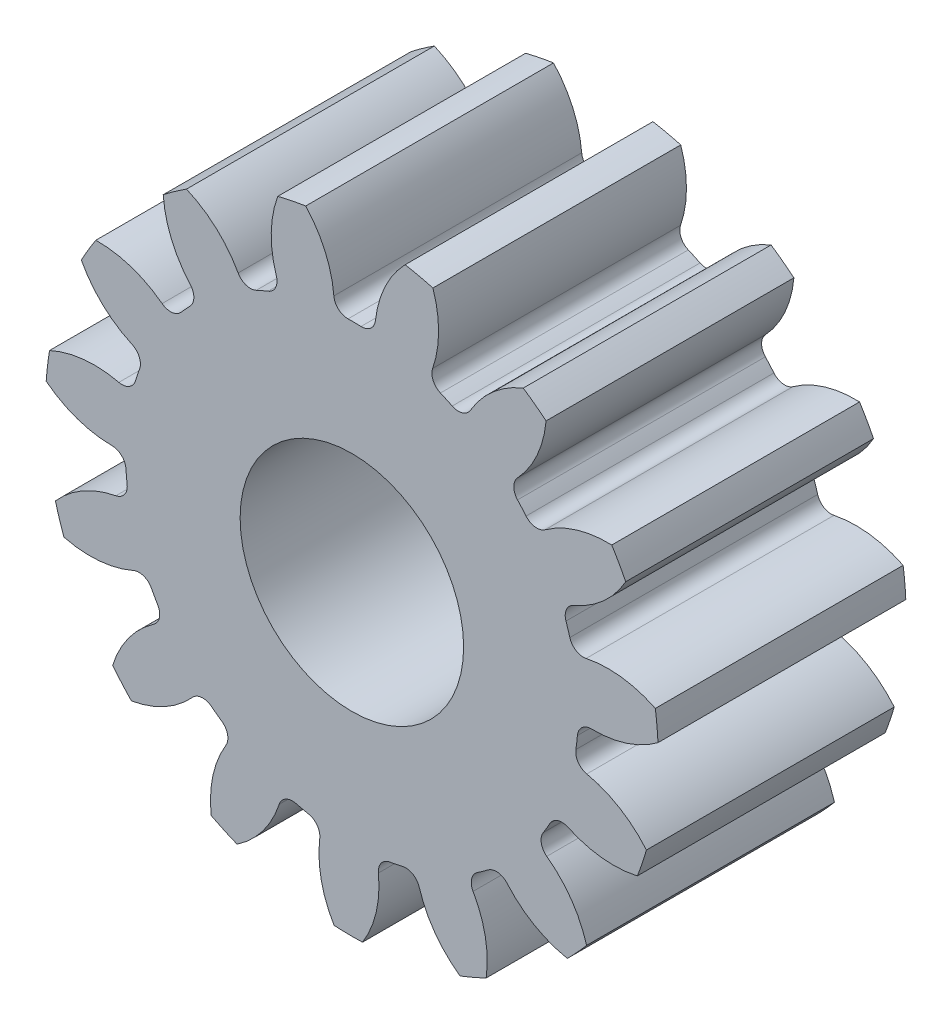
from build123d import *

# Parameters (mm, degrees)
SKETCH3_R         = 21.59
GEARBODY_DEPTH    = 17.4625
TOOTHCUT_DEPTH    = 36.173784361
CIRPATTERN1_COUNT = 15
BOREDIA_R         = 7.874
BORE_DEPTH        = 12700


with BuildPart() as part:
    # Sketch3 → gearBody (new body)
    with BuildSketch(Plane.XY):
        Circle(SKETCH3_R)
    extrude(amount=GEARBODY_DEPTH)

    # Sketch2 → toothCut (cut, through all)
    with BuildSketch(Plane.XY):
        with BuildLine():
            ThreePointArc((15.783846764, -2.304552616), (15.843293638, -1.852249483), (15.889781974, -1.39843136))
            ThreePointArc((15.889781974, -1.39843136), (16.213055843, -0.751556907), (16.890861518, -0.499501321))
            ThreePointArc((16.890861518, -0.499501321), (20.504912911, 0.340315353), (23.283949955, 2.798691365))
            ThreePointArc((23.283949955, 2.798691365), (23.292901215, -2.723187818), (22.010467945, -8.09409042))
            ThreePointArc((22.010467945, -8.09409042), (19.873444675, -5.060974685), (16.550574786, -3.410158156))
            ThreePointArc((16.550574786, -3.410158156), (15.949189176, -3.008551507), (15.783846764, -2.304552616))
        make_face()
    toothcut = extrude(amount=TOOTHCUT_DEPTH, mode=Mode.SUBTRACT)

    # CirPattern1: toothCut ×15 about axis
    cirpattern1_axis = Axis((0, 0, 17.4625), (0, 0, -1))
    for i in range(1, CIRPATTERN1_COUNT):
        add(toothcut.rotate(cirpattern1_axis, i * 360 / CIRPATTERN1_COUNT), mode=Mode.SUBTRACT)

    # boreDia → bore (cut, symmetric)
    with BuildSketch(Plane.XY):
        Circle(BOREDIA_R)
    extrude(amount=BORE_DEPTH, both=True, mode=Mode.SUBTRACT)


solid = part.part
